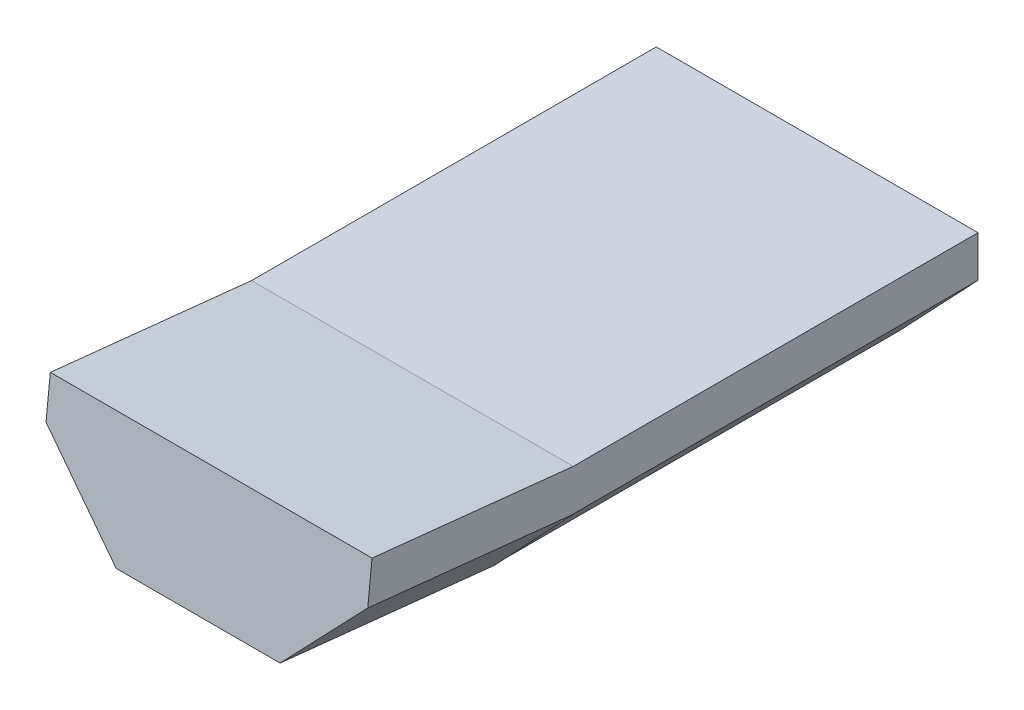
from build123d import *

# Parameters (mm, degrees)
BOSS_EXTRUDE1_DEPTH = 20
BOSS_EXTRUDE2_DEPTH = 2
BOSS_EXTRUDE3_REACH = 34.14


with BuildPart() as part:
    # Sketch3 → Boss-Extrude1 (new body)
    with BuildSketch(Plane.XY):
        Polygon((-7.95, 0), (7.95, 0), (7.95, -2.04), (4.05, -6.155689493), (-4.05, -6.155689493), (-7.95, -2.04), align=None)
    extrude(amount=BOSS_EXTRUDE1_DEPTH)

    # Sketch4 → Boss-Extrude2 (add, symmetric)
    with BuildSketch(Plane(origin=(0, 0, 0), x_dir=(0, 0, -1), z_dir=(1, 0, 0))):
        Polygon((-20, 0), (-29.945218954, 1.045284633), (-30.15427588, -0.943759158), (-20, -2.011016559), align=None)
    extrude(amount=BOSS_EXTRUDE2_DEPTH, both=True)

    # Boss-Extrude3: up to this plane
    boss_extrude3_end = Plane(origin=(0, 0, 20), z_dir=(0, 0, 1))
    # Sketch5 → Boss-Extrude3 (add, up to the surface)
    with BuildSketch(Plane(origin=(0, 3.124401541, 29.726694961), x_dir=(1, 0, 0), z_dir=(0, 0.10452846326764606, 0.9945218953682741)), mode=Mode.PRIVATE) as boss_extrude3_sk1:
        Polygon((-7.95, -4.130569265), (-4.05, -8.246258758), (4.05, -8.246258758), (7.95, -4.130569265), (7.95, -2.090569265), (-7.95, -2.090569265), align=None)
    boss_extrude3_tool1 = split(extrude(boss_extrude3_sk1.sketch, amount=-BOSS_EXTRUDE3_REACH, mode=Mode.PRIVATE), bisect_by=boss_extrude3_end, keep=Keep.BOTH, mode=Mode.PRIVATE)
    add(boss_extrude3_tool1.solids().sort_by_distance((0, -1.682883, 30.231961))[0])


solid = part.part
